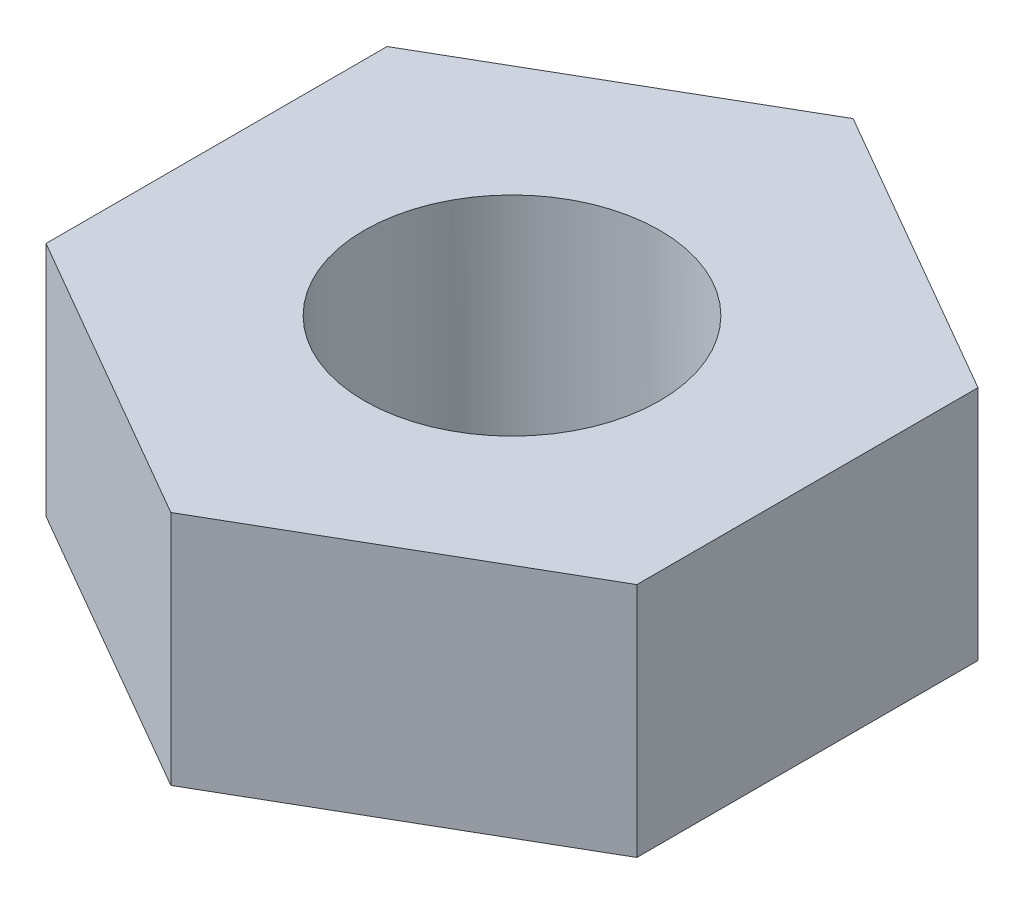
from build123d import *

# Parameters (mm, degrees)
BOSS_EXTRUDE1_DEPTH     = 1.6
CUT_EXTRUDE1_DEPTH      = 4.448671242
CUT_EXTRUDE1_DEPTH_BACK = 4.448671242
SKETCH2_R               = 1


with BuildPart() as part:
    # Sketch1 → Boss-Extrude1 (new body)
    with BuildSketch(Plane(origin=(0, 0, 0), x_dir=(1, 0, 0), z_dir=(0, 1, 0))):
        Polygon((2, -1.154700538), (0, -2.309401077), (-2, -1.154700538), (-2, 1.154700538), (0, 2.309401077), (2, 1.154700538), align=None)
    extrude(amount=-BOSS_EXTRUDE1_DEPTH)

    # Sketch2 → Cut-Extrude1 (cut, two sides: drawn at the far end of the back side and taken through both)
    with BuildSketch(Plane(origin=(0, 0, 0), x_dir=(1, 0, 0), z_dir=(0, 1, 0)).offset(-CUT_EXTRUDE1_DEPTH_BACK)):
        Circle(SKETCH2_R)
    extrude(amount=CUT_EXTRUDE1_DEPTH + CUT_EXTRUDE1_DEPTH_BACK, mode=Mode.SUBTRACT)


solid = part.part
